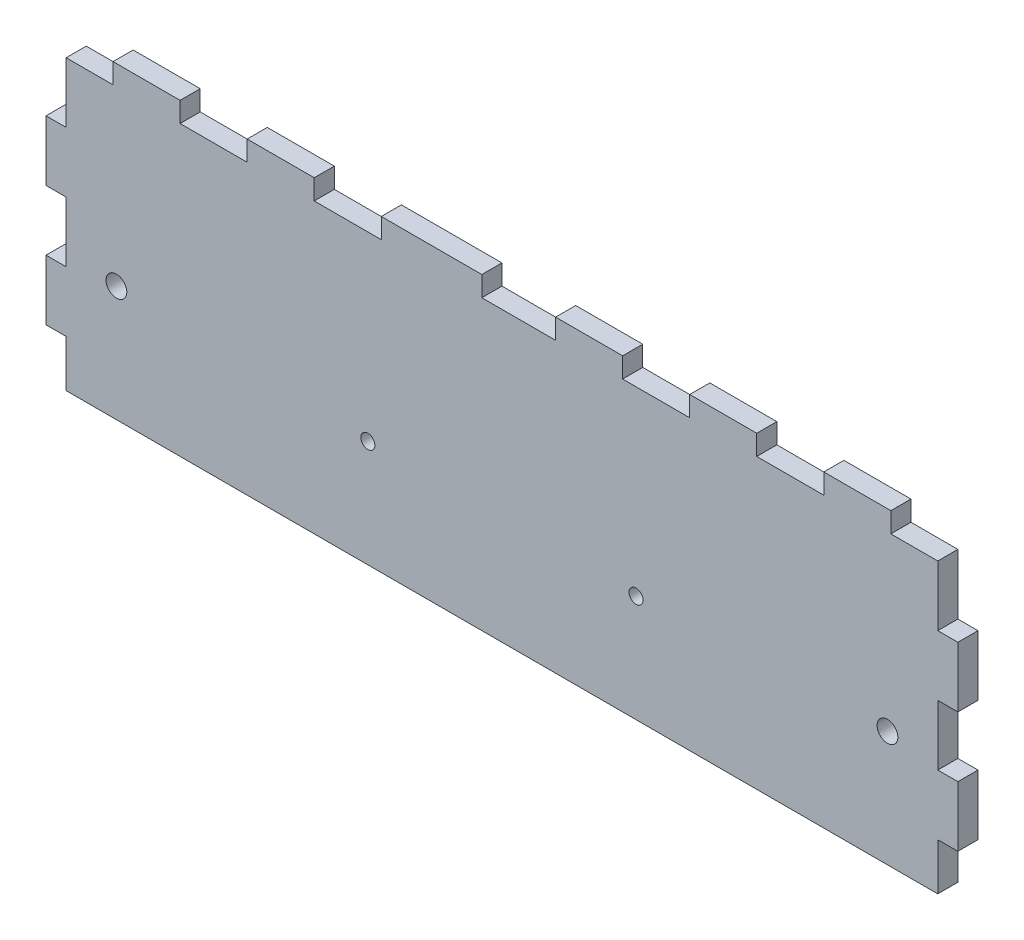
from build123d import *

# Parameters (mm, degrees)
SKETCH1_W           = 136
SKETCH1_H           = 46
SKETCH1_R           = 1.05
SKETCH1_R_2         = 1.55
BOSS_EXTRUDE1_DEPTH = 3
CUT_EXTRUDE1_REACH  = 145.6
SKETCH2_W           = 3
SKETCH2_H           = 9
SKETCH2_W_2         = 10
SKETCH2_H_2         = 3
SKETCH2_H_3         = 7
SKETCH2_W_3         = 11


with BuildPart() as part:
    # Sketch1 → Boss-Extrude1 (new body)
    with BuildSketch(Plane.XY):
        with Locations((-68, 23)):
            Rectangle(SKETCH1_W, SKETCH1_H)
        with Locations((-88, 15.95)):
            Circle(SKETCH1_R, mode=Mode.SUBTRACT)
        with Locations((-125.5, 17.25)):
            Circle(SKETCH1_R_2, mode=Mode.SUBTRACT)
        with Locations((-48, 15.95)):
            Circle(SKETCH1_R, mode=Mode.SUBTRACT)
        with Locations((-10.5, 17.25)):
            Circle(SKETCH1_R_2, mode=Mode.SUBTRACT)
    extrude(amount=BOSS_EXTRUDE1_DEPTH)

    # Sketch2 → Cut-Extrude1 (cut, up to next)
    with BuildSketch(Plane.XY.offset(3), mode=Mode.PRIVATE) as cut_extrude1_sk1:
        Polygon((-133, 34), (-133, 43), (-126, 43), (-126, 46), (-136, 46), (-136, 34), align=None)
    cut_extrude1_tool1 = extrude(cut_extrude1_sk1.sketch, amount=-CUT_EXTRUDE1_REACH, mode=Mode.PRIVATE) & part.part
    # Sketch2 → Cut-Extrude1 (cut, up to next)
    with BuildSketch(Plane.XY.offset(3), mode=Mode.PRIVATE) as cut_extrude1_sk2:
        with Locations((-134.5, 20.5)):
            Rectangle(SKETCH2_W, SKETCH2_H)
    cut_extrude1_tool2 = extrude(cut_extrude1_sk2.sketch, amount=-CUT_EXTRUDE1_REACH, mode=Mode.PRIVATE) & part.part
    # Sketch2 → Cut-Extrude1 (cut, up to next)
    with BuildSketch(Plane.XY.offset(3), mode=Mode.PRIVATE) as cut_extrude1_sk3:
        with Locations((-111, 44.5)):
            Rectangle(SKETCH2_W_2, SKETCH2_H_2)
    cut_extrude1_tool3 = extrude(cut_extrude1_sk3.sketch, amount=-CUT_EXTRUDE1_REACH, mode=Mode.PRIVATE) & part.part
    # Sketch2 → Cut-Extrude1 (cut, up to next)
    with BuildSketch(Plane.XY.offset(3), mode=Mode.PRIVATE) as cut_extrude1_sk4:
        with Locations((-134.5, 3.5)):
            Rectangle(SKETCH2_W, SKETCH2_H_3)
    cut_extrude1_tool4 = extrude(cut_extrude1_sk4.sketch, amount=-CUT_EXTRUDE1_REACH, mode=Mode.PRIVATE) & part.part
    # Sketch2 → Cut-Extrude1 (cut, up to next)
    with BuildSketch(Plane.XY.offset(3), mode=Mode.PRIVATE) as cut_extrude1_sk5:
        with Locations((-91, 44.5)):
            Rectangle(SKETCH2_W_2, SKETCH2_H_2)
    cut_extrude1_tool5 = extrude(cut_extrude1_sk5.sketch, amount=-CUT_EXTRUDE1_REACH, mode=Mode.PRIVATE) & part.part
    # Sketch2 → Cut-Extrude1 (cut, up to next)
    with BuildSketch(Plane.XY.offset(3), mode=Mode.PRIVATE) as cut_extrude1_sk6:
        with Locations((-65.5, 44.5)):
            Rectangle(SKETCH2_W_3, SKETCH2_H_2)
    cut_extrude1_tool6 = extrude(cut_extrude1_sk6.sketch, amount=-CUT_EXTRUDE1_REACH, mode=Mode.PRIVATE) & part.part
    # Sketch2 → Cut-Extrude1 (cut, up to next)
    with BuildSketch(Plane.XY.offset(3), mode=Mode.PRIVATE) as cut_extrude1_sk7:
        with Locations((-1.5, 3.5)):
            Rectangle(SKETCH2_W, SKETCH2_H_3)
    cut_extrude1_tool7 = extrude(cut_extrude1_sk7.sketch, amount=-CUT_EXTRUDE1_REACH, mode=Mode.PRIVATE) & part.part
    # Sketch2 → Cut-Extrude1 (cut, up to next)
    with BuildSketch(Plane.XY.offset(3), mode=Mode.PRIVATE) as cut_extrude1_sk8:
        with Locations((-45, 44.5)):
            Rectangle(SKETCH2_W_2, SKETCH2_H_2)
    cut_extrude1_tool8 = extrude(cut_extrude1_sk8.sketch, amount=-CUT_EXTRUDE1_REACH, mode=Mode.PRIVATE) & part.part
    # Sketch2 → Cut-Extrude1 (cut, up to next)
    with BuildSketch(Plane.XY.offset(3), mode=Mode.PRIVATE) as cut_extrude1_sk9:
        with Locations((-1.5, 20.5)):
            Rectangle(SKETCH2_W, SKETCH2_H)
    cut_extrude1_tool9 = extrude(cut_extrude1_sk9.sketch, amount=-CUT_EXTRUDE1_REACH, mode=Mode.PRIVATE) & part.part
    # Sketch2 → Cut-Extrude1 (cut, up to next)
    with BuildSketch(Plane.XY.offset(3), mode=Mode.PRIVATE) as cut_extrude1_sk10:
        with Locations((-25, 44.5)):
            Rectangle(SKETCH2_W_2, SKETCH2_H_2)
    cut_extrude1_tool10 = extrude(cut_extrude1_sk10.sketch, amount=-CUT_EXTRUDE1_REACH, mode=Mode.PRIVATE) & part.part
    # Sketch2 → Cut-Extrude1 (cut, up to next)
    with BuildSketch(Plane.XY.offset(3), mode=Mode.PRIVATE) as cut_extrude1_sk11:
        Polygon((-3, 34), (0, 34), (0, 46), (-10, 46), (-10, 43), (-3, 43), align=None)
    cut_extrude1_tool11 = extrude(cut_extrude1_sk11.sketch, amount=-CUT_EXTRUDE1_REACH, mode=Mode.PRIVATE) & part.part
    add(cut_extrude1_tool1.solids().sort_by_distance((-135.843795, 40, 3))[0], mode=Mode.SUBTRACT)
    add(cut_extrude1_tool2.solids().sort_by_distance((-134.5, 20.5, 3))[0], mode=Mode.SUBTRACT)
    add(cut_extrude1_tool3.solids().sort_by_distance((-111, 44.5, 3))[0], mode=Mode.SUBTRACT)
    add(cut_extrude1_tool4.solids().sort_by_distance((-134.5, 3.5, 3))[0], mode=Mode.SUBTRACT)
    add(cut_extrude1_tool5.solids().sort_by_distance((-91, 44.5, 3))[0], mode=Mode.SUBTRACT)
    add(cut_extrude1_tool6.solids().sort_by_distance((-65.5, 44.5, 3))[0], mode=Mode.SUBTRACT)
    add(cut_extrude1_tool7.solids().sort_by_distance((-1.5, 3.5, 3))[0], mode=Mode.SUBTRACT)
    add(cut_extrude1_tool8.solids().sort_by_distance((-45, 44.5, 3))[0], mode=Mode.SUBTRACT)
    add(cut_extrude1_tool9.solids().sort_by_distance((-1.5, 20.5, 3))[0], mode=Mode.SUBTRACT)
    add(cut_extrude1_tool10.solids().sort_by_distance((-25, 44.5, 3))[0], mode=Mode.SUBTRACT)
    add(cut_extrude1_tool11.solids().sort_by_distance((-2.843795, 38.5, 3))[0], mode=Mode.SUBTRACT)


solid = part.part
